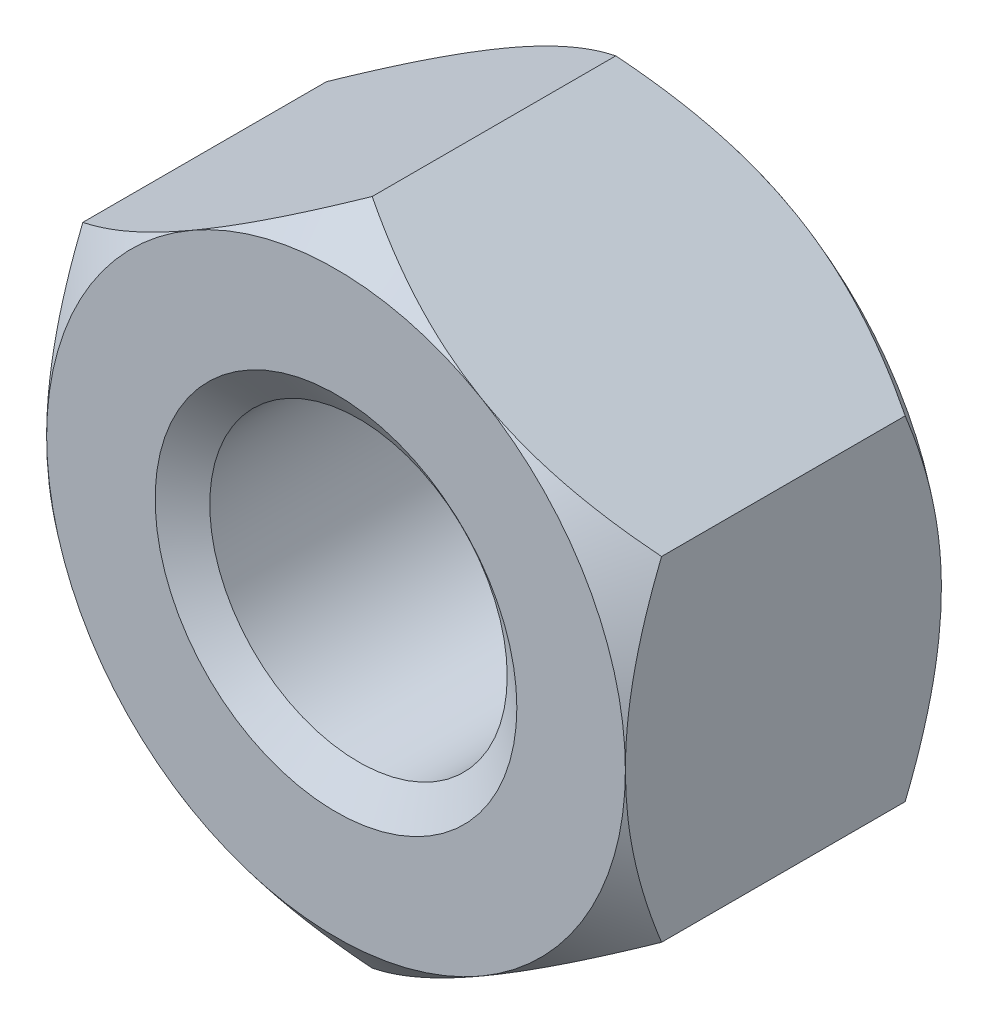
from build123d import *

# Parameters (mm, degrees)
BASENUT_START = -6.9342
BASENUTSKE_R  = 3.2639
BASENUT_DEPTH = 6.9342


# Read off the part's stored shape, not the designer's step: ThreadSchematic
with BuildPart() as part:
    # BaseNutSke → BaseNut (new body)
    with BuildSketch(Plane.XY.offset(BASENUT_START)):
        Polygon((6.35, 3.666174209), (6.35, -3.666174209), (0, -7.332348419), (-6.35, -3.666174209), (-6.35, 3.666174209), (0, 7.332348419), align=None)
        Circle(BASENUTSKE_R, mode=Mode.SUBTRACT)
    extrude(amount=BASENUT_DEPTH)

    # Sketch5 (on Front Plane) → EndChamfer (revolve, cut)
    with BuildSketch(Plane.XY):
        Polygon((6.9088, 3.96875), (6.365904588, 3.193415), (6.9596, 3.193415), (6.9596, 3.96875), align=None)
    revolve(axis=Axis((6.9088, 3.96875, 0), (-0.5735764363510457, -0.819152044288992, 0)), mode=Mode.SUBTRACT)

    # Sketch3 → Double-Chamfer (revolve, cut)
    with BuildSketch(Plane(origin=(0, 0, 0), x_dir=(0, 0, -1), z_dir=(1, 0, 0))):
        Polygon((6.9342, 6.35), (6.14045, 7.332348419), (6.14045, 20.032348419), (19.6342, 20.032348419), (19.6342, 6.35), align=None)
        Polygon((0.79375, 20.032348419), (-12.7, 20.032348419), (-12.7, 6.35), (0, 6.35), (0.79375, 7.332348419), align=None)
    revolve(axis=Axis((0, 0, 0), (0, 0, -1)), mode=Mode.SUBTRACT)

    # ThreadSchematic outline → ThreadSchematic (revolve, cut)
    with BuildSketch(Plane.XZ):
        Polygon((3.2639, 0), (3.2639, -0.493541283), (3.96875, 0), align=None)
        Polygon((3.96875, -6.9088), (3.2639, -6.415258717), (3.2639, -6.9342), (3.96875, -6.9342), align=None)
    revolve(axis=Axis((0, 0, 0), (0, 0, 1)), mode=Mode.SUBTRACT)


solid = part.part
